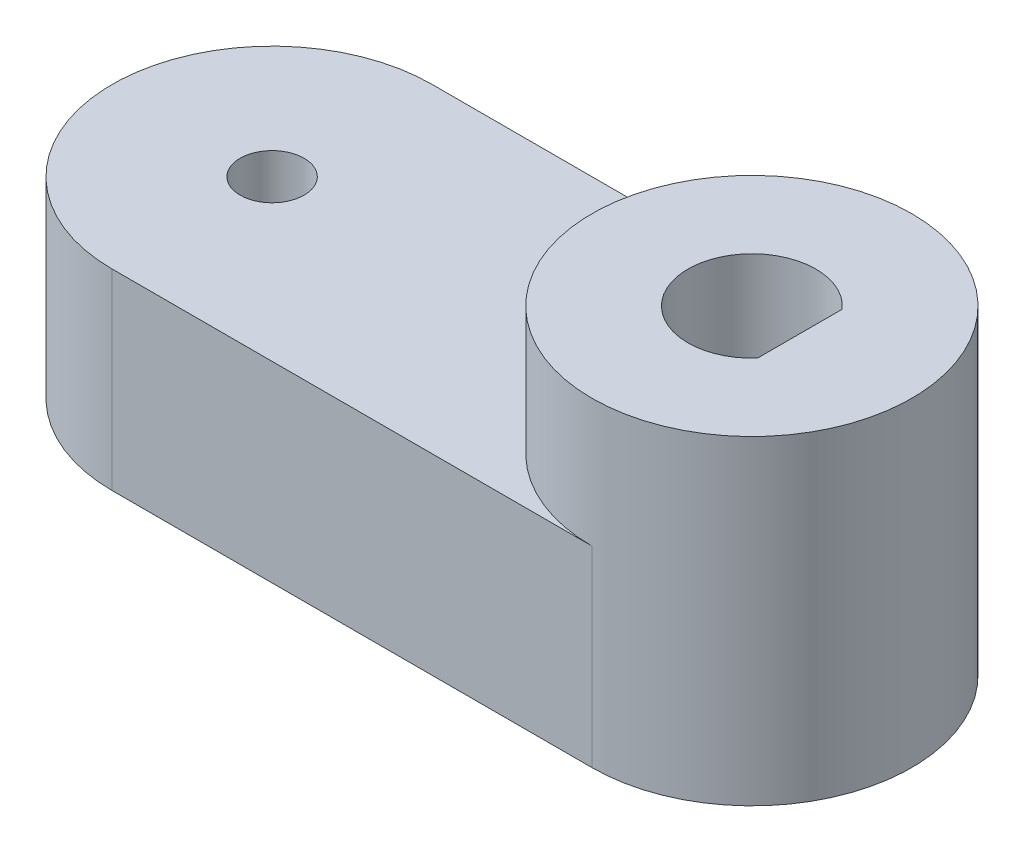
from build123d import *
from build123d.topology import SkipClean

# Parameters (mm, degrees)
SKETCH1_R           = 1
BOSS_EXTRUDE1_DEPTH = 6
SKETCH2_R           = 5
BOSS_EXTRUDE2_DEPTH = 4
CUT_EXTRUDE1_DEPTH  = 23.912878475


with BuildPart() as part:
    # Sketch1 → Boss-Extrude1 (new body)
    with BuildSketch(Plane(origin=(0, 0, 0), x_dir=(1, 0, 0), z_dir=(0, 1, 0))):
        with BuildLine():
            Line((0, 5), (15, 5))
            ThreePointArc((15, 5), (20, 0), (15, -5))
            Line((15, -5), (0, -5))
            ThreePointArc((0, -5), (-5, 0), (0, 5))
        make_face()
        Circle(SKETCH1_R, mode=Mode.SUBTRACT)
    extrude(amount=BOSS_EXTRUDE1_DEPTH)

    # Sketch2 → Boss-Extrude2 (add)
    with SkipClean():  # the faces are left unmerged after this step: merging them gives an invalid solid
        with BuildSketch(Plane(origin=(0, 6, 0), x_dir=(1, 0, 0), z_dir=(0, 1, 0))):
            with Locations((15, 0)):
                Circle(SKETCH2_R)
        extrude(amount=BOSS_EXTRUDE2_DEPTH)
    add(part.part.scale(1), mode=Mode.REPLACE)  # the faces are merged on a copy

    # Sketch3 → Cut-Extrude1 (cut, through all)
    with BuildSketch(Plane(origin=(0, 10, 0), x_dir=(1, 0, 0), z_dir=(0, 1, 0))):
        with BuildLine():
            Line((16.5, -1.322875656), (16.5, 1.322875656))
            ThreePointArc((16.5, 1.322875656), (13, 0), (16.5, -1.322875656))
        make_face()
    extrude(amount=-CUT_EXTRUDE1_DEPTH, mode=Mode.SUBTRACT)


solid = part.part
